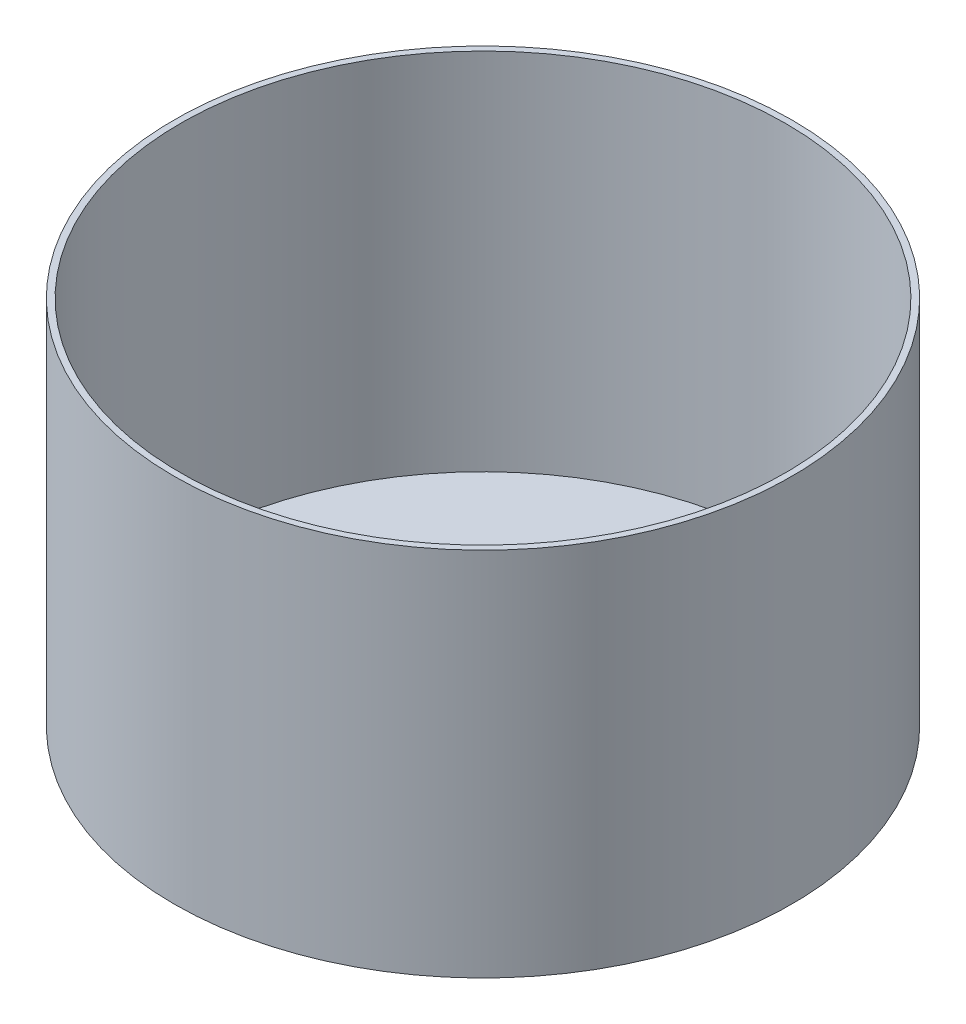
from build123d import *

# Parameters (mm, degrees)
SKETCH1_R           = 127
BOSS_EXTRUDE1_DEPTH = 152.4
SHELL1_T            = -2.54


with BuildPart() as part:
    # Sketch1 → Boss-Extrude1 (new body)
    with BuildSketch(Plane(origin=(0, 0, 0), x_dir=(1, 0, 0), z_dir=(0, 1, 0))):
        Circle(SKETCH1_R)
    extrude(amount=BOSS_EXTRUDE1_DEPTH)

    # Shell1
    shell1_openings = [part.faces().sort_by_distance(p)[0] for p in [
        (0, 152.4, 0),
    ]]
    offset(amount=SHELL1_T, openings=shell1_openings, kind=Kind.INTERSECTION)


solid = part.part
